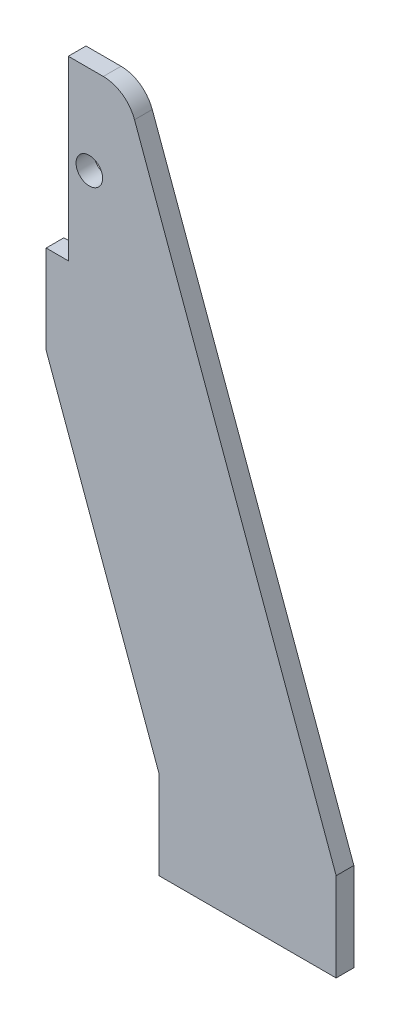
from build123d import *

# Parameters (mm, degrees)
SALIENTE_EXTRUIR1_DEPTH = 8
CROQUIS2_R              = 6
CORTAR_EXTRUIR1_DEPTH   = 311.586541885


with BuildPart() as part:
    # Croquis1 → Saliente-Extruir1 (new body)
    with BuildSketch(Plane.XY):
        with BuildLine():
            Line((80, 0), (80, 40))
            Line((80, 40), (-11.039984671, 290.13030215))
            ThreePointArc((-11.039984671, 290.13030215), (-16.531727437, 297.287280664), (-25.135373982, 300))
            Line((-25.135373982, 300), (-40.955832797, 300))
            Line((-40.955832797, 300), (-40.955832797, 220))
            Line((-40.955832797, 220), (-50.955832797, 220))
            Line((-50.955832797, 220), (-50.955832797, 180))
            Line((-50.955832797, 180), (0, 40))
            Line((0, 40), (0, 0))
            Line((0, 0), (80, 0))
        make_face()
    extrude(amount=SALIENTE_EXTRUIR1_DEPTH)

    # Croquis2 → Cortar-Extruir1 (cut, through all)
    with BuildSketch(Plane(origin=(0, 0, 0), x_dir=(-1, 0, 0), z_dir=(0, 0, -1))):
        with Locations((31.455832797, 260)):
            Circle(CROQUIS2_R)
    extrude(amount=-CORTAR_EXTRUIR1_DEPTH, mode=Mode.SUBTRACT)


solid = part.part
